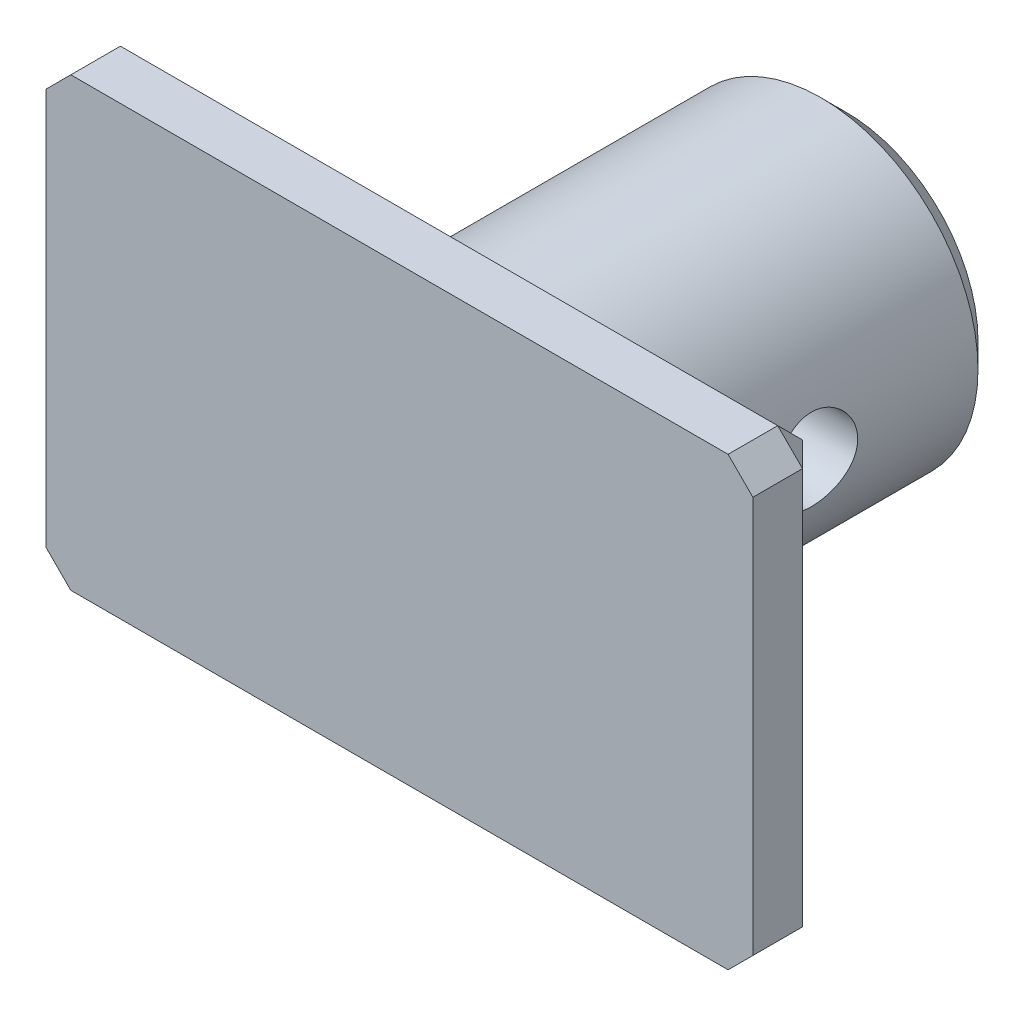
from build123d import *

# Parameters (mm, degrees)
SKETCH_1_R               = 6.325
EXTRUDE_1_DEPTH          = 15
SKETCH_2_W               = 28.5
SKETCH_2_H               = 18
EXTRUDE_2_DEPTH          = 3
EXTRUDE_START            = 14.25
SKETCH_4_R               = 1.6
EXTRUDE_3_DEPTH          = 7
EXTRUDE_START_2          = -7.25
SKETCH_4_2_R             = 1.6
EXTRUDE_4_DEPTH          = 7
EXTRUDE_START_3          = -7
EXTRUDE_5_DEPTH          = 7
SKETCH_7_R               = 1.75
CUT_EXTRUDE_1_DEPTH      = 65.242217427
CHAMFER_1_SIZE           = 1
CHAMFER_2_SIZE           = 1
CUT_EXTRUDE_2_DEPTH      = 64.238141181
CUT_EXTRUDE_2_DEPTH_BACK = 64.238141181
SKETCH_8_R               = 1.65
CUT_EXTRUDE_START        = -18
CUT_EXTRUDE_3_OUTLINE_W  = 7
CUT_EXTRUDE_3_OUTLINE_H  = 43
CUT_EXTRUDE_3_OUTLINE_R  = 1.75
CUT_EXTRUDE_3_DEPTH      = 23


# Read off the part's stored shape, not the designer's step: ｶｯﾄ - 押し出し3
with BuildPart() as part:
    # ｽｹｯﾁ1 → ﾎﾞｽ - 押し出し1 (new body)
    with BuildSketch(Plane.XY):
        Circle(SKETCH_1_R)
    extrude(amount=EXTRUDE_1_DEPTH)

    # ｽｹｯﾁ2 → ﾎﾞｽ - 押し出し2 (add)
    with BuildSketch(Plane.XY.offset(15)):
        Rectangle(SKETCH_2_W, SKETCH_2_H)
    extrude(amount=EXTRUDE_2_DEPTH)

    # ｽｹｯﾁ4 → ﾎﾞｽ - 押し出し3 (add)
    with BuildSketch(Plane(origin=(0, 0, 0), x_dir=(0, 0, -1), z_dir=(1, 0, 0)).offset(EXTRUDE_START)):
        with BuildLine():
            Line((-54.074074074, 13.913518208), (-28, 9))
            Line((-28, 9), (-18, 9))
            Line((-18, 9), (-18, -9))
            Line((-18, -9), (-56.624751337, 4.271344473))
            ThreePointArc((-56.624751337, 4.271344473), (-59.833732287, 10.278683768), (-54.074074074, 13.913518208))
        make_face()
        with Locations(Location((-55, 9, 0), (0, 0, 270))):
            Circle(SKETCH_4_R, mode=Mode.SUBTRACT)
    extrude(amount=-EXTRUDE_3_DEPTH)

    # ｽｹｯﾁ4<2> → ﾎﾞｽ - 押し出し4 (add)
    with BuildSketch(Plane(origin=(0, 0, 0), x_dir=(0, 0, -1), z_dir=(1, 0, 0)).offset(EXTRUDE_START_2)):
        with BuildLine():
            Line((-54.074074074, 13.913518208), (-28, 9))
            Line((-28, 9), (-18, 9))
            Line((-18, 9), (-18, -9))
            Line((-18, -9), (-56.624751337, 4.271344473))
            ThreePointArc((-56.624751337, 4.271344473), (-59.833732287, 10.278683768), (-54.074074074, 13.913518208))
        make_face()
        with Locations(Location((-55, 9, 0), (0, 0, 270))):
            Circle(SKETCH_4_2_R, mode=Mode.SUBTRACT)
    extrude(amount=-EXTRUDE_4_DEPTH)

    # ｽｹｯﾁ5 → ﾎﾞｽ - 押し出し5 (add)
    with BuildSketch(Plane.ZY.offset(14.25).offset(EXTRUDE_START_3)):
        with BuildLine():
            Line((18, -9), (33.823085464, -9))
            Line((33.823085464, -9), (57.5, 4.669872981))
            ThreePointArc((57.5, 4.669872981), (57.071979643, 4.44951647), (56.624751337, 4.271344473))
            Line((56.624751337, 4.271344473), (18, -9))
        make_face()
    extrude_5 = extrude(amount=EXTRUDE_5_DEPTH)

    # ﾐﾗｰ1: ﾎﾞｽ - 押し出し5 across plane
    add(extrude_5.mirror(Plane(origin=(0, 0, 0), x_dir=(0, 0, 1), z_dir=(1, 0, 0))))

    # ｽｹｯﾁ7 → ｶｯﾄ - 押し出し1 (cut, through all)
    with BuildSketch(Plane(origin=(0, 9, 0), x_dir=(1, 0, 0), z_dir=(0, 1, 0))):
        with Locations(Location((10.75, -23, 0), (0, 0, 270))):
            Circle(SKETCH_7_R)
        with Locations(Location((-10.75, -23, 0), (0, 0, 90))):
            Circle(SKETCH_7_R)
    extrude(amount=-CUT_EXTRUDE_1_DEPTH, mode=Mode.SUBTRACT)

    # 面取り1
    chamfer_1_edges = [part.edges().sort_by_distance(p)[0] for p in [
        (14.25, 11.456759104, 41.037037037),
        (-14.25, 11.456759104, 41.037037037),
        (-14.25, 10.737621487, 59.688354889),
        (-14.25, -2.165063509, 45.661542732),
        (14.25, 0, 15),
        (14.25, -9, 24.411542732),
        (0, 9, 15),
        (14.25, 10.737621487, 59.688354889),
        (14.25, 9, 21.5),
        (-14.25, 0, 15),
        (14.25, -2.165063509, 45.661542732),
        (-14.25, 9, 21.5),
        (0, -9, 15),
        (-14.25, -9, 24.411542732),
    ]]
    chamfer(chamfer_1_edges, length=CHAMFER_1_SIZE)

    # 面取り2
    chamfer_2_edges = [part.edges().sort_by_distance(p)[0] for p in [
        (-6.325, 0, 0),
    ]]
    chamfer(chamfer_2_edges, length=CHAMFER_2_SIZE)

    # ｽｹｯﾁ8 → ｶｯﾄ - 押し出し2 (cut, two sides: drawn at the far end of the back side and taken through both)
    with BuildSketch(Plane(origin=(0, 0, 0), x_dir=(0, 0, -1), z_dir=(1, 0, 0)).offset(-CUT_EXTRUDE_2_DEPTH_BACK)):
        with Locations(Location((-7.5, 0, 0), (0, 0, 180))):
            Circle(SKETCH_8_R)
    extrude(amount=CUT_EXTRUDE_2_DEPTH + CUT_EXTRUDE_2_DEPTH_BACK, mode=Mode.SUBTRACT)

    # ｶｯﾄ - 押し出し3 outline → ｶｯﾄ - 押し出し3 (cut)
    # profile 1 of 2: a face of its own
    with BuildSketch(Plane(origin=(0, 9, 0), x_dir=(1, 0, 0), z_dir=(0, 1, 0)).offset(CUT_EXTRUDE_START)):
        with Locations((-10.75, -39.5)):
            Rectangle(CUT_EXTRUDE_3_OUTLINE_W, CUT_EXTRUDE_3_OUTLINE_H)
        with Locations((-10.75, -23)):
            Circle(CUT_EXTRUDE_3_OUTLINE_R, mode=Mode.SUBTRACT)
    # profile 2 of 2: a face of its own
    with BuildSketch(Plane(origin=(0, 9, 0), x_dir=(1, 0, 0), z_dir=(0, 1, 0)).offset(CUT_EXTRUDE_START)):
        with Locations((10.75, -39.5)):
            Rectangle(CUT_EXTRUDE_3_OUTLINE_W, CUT_EXTRUDE_3_OUTLINE_H)
        with Locations((10.75, -23)):
            Circle(CUT_EXTRUDE_3_OUTLINE_R, mode=Mode.SUBTRACT)
    extrude(amount=CUT_EXTRUDE_3_DEPTH, mode=Mode.SUBTRACT)


solid = part.part
